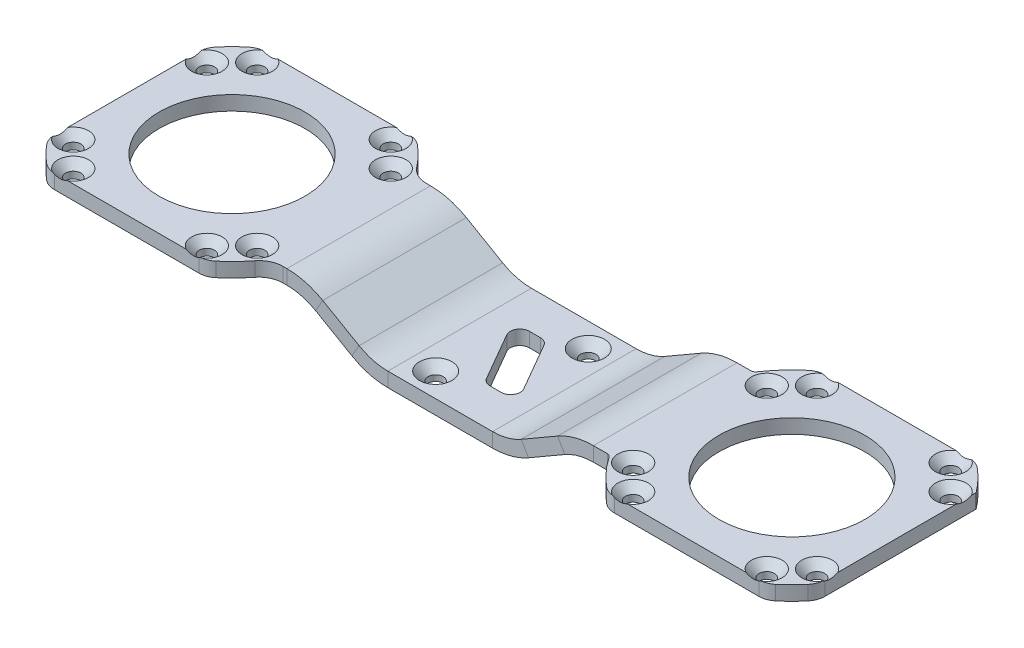
from build123d import *

# Parameters (mm, degrees)
SM_BASE_FLANGE_3_DEPTH       = 3
OTHER_START                  = -3
OTHER_2_DEPTH                = 3
OTHER_START_2                = 5
OTHER_2_2_DEPTH              = 3
OTHER_START_3                = -22
OTHER_2_3_DEPTH              = 44
OTHER_START_4                = -15
OTHER_2_4_DEPTH              = 30
OTHER_START_5                = -4
OTHER_2_5_DEPTH              = 9
OTHER_2_6_DEPTH              = 3
OTHER_2_7_DEPTH              = 3
SKETCH_15_R                  = 11.525
CUT_EXTRUDE_1_DEPTH          = 50
OTHER_4_DEPTH                = 44
OTHER_4_2_DEPTH              = 3.4749999
OTHER_START_6                = 11.5250001
OTHER_4_3_DEPTH              = 3.4749999
OTHER_4_4_DEPTH              = 44
OTHER_START_7                = -11
OTHER_4_5_OUTLINE_R          = 11.525
OTHER_4_5_DEPTH              = 11
SKETCH_31_R                  = 1.6
CUT_EXTRUDE_2_DEPTH          = 10
CUT_EXTRUDE_5_DEPTH          = 56
FILLET_2_R                   = 2
FILLET_7_R                   = 4
FILLET_8_R                   = 5
FILLET_9_R                   = 1
SKETCH_45_R                  = 1.6
CUT_EXTRUDE_6_DEPTH          = 10
SKETCH_51_R                  = 15.25
CUT_EXTRUDE_8_DEPTH          = 143.943624145
HOLE_WIZARD_M3_1_D           = 3.2
HOLE_WIZARD_M3_1_DEPTH       = 3
HOLE_WIZARD_M3_1_CSINK_D     = 6.4
HOLE_WIZARD_M3_1_CSINK_ANGLE = 90
HOLE_WIZARD_M3_1_TIP         = 0.96137699
HOLE_WIZARD_M3_2_D           = 3.2
HOLE_WIZARD_M3_2_DEPTH       = 3.3
HOLE_WIZARD_M3_2_CSINK_D     = 6.8
HOLE_WIZARD_M3_2_CSINK_ANGLE = 90
HOLE_WIZARD_M3_2_TIP         = 0.96137699


with BuildPart() as part:
    # 基体-法兰3: sheet metal written as solids
    # Sketch 1 → 基体-法兰3 (new body)
    with BuildSketch(Plane(origin=(0, 0, 0), x_dir=(1, 0, 0), z_dir=(0, 1, 0))):
        with BuildLine():
            Line((23.048861143, 15), (93.951138857, 15))
            ThreePointArc((93.951138857, 15), (96.91821461, 18.787546289), (100.5, 22))
            Line((100.5, 22), (133.5, 22))
            ThreePointArc((133.5, 22), (136.445436483, 19.445436483), (139, 16.5))
            Line((139, 16.5), (139, -16.5))
            ThreePointArc((139, -16.5), (136.445436483, -19.445436483), (133.5, -22))
            Line((133.5, -22), (100.5, -22))
            ThreePointArc((100.5, -22), (96.91821461, -18.787546289), (93.951138857, -15))
            Line((93.951138857, -15), (23.048861143, -15))
            ThreePointArc((23.048861143, -15), (20.08178539, -18.787546289), (16.5, -22))
            Line((16.5, -22), (-16.5, -22))
            ThreePointArc((-16.5, -22), (-19.445436483, -19.445436483), (-22, -16.5))
            Line((-22, -16.5), (-22, 16.5))
            ThreePointArc((-22, 16.5), (-19.445436483, 19.445436483), (-16.5, 22))
            Line((-16.5, 22), (16.5, 22))
            ThreePointArc((16.5, 22), (20.08178539, 18.787546289), (23.048861143, 15))
        make_face()
    extrude(amount=-SM_BASE_FLANGE_3_DEPTH)

    # Other 2: read off the stored shape, not the designer's step
    # Other 2 outline → Other 2 (cut)
    with BuildSketch(Plane(origin=(0, 0, 0), x_dir=(1, 0, 0), z_dir=(0, 1, 0)).offset(OTHER_START)):
        with BuildLine():
            ThreePointArc((-20.188495911, 16.5), (-17.633932394, 19.445436482), (-14.688495911, 22))
            Line((-14.688495911, 22), (-16.5, 22))
            ThreePointArc((-16.5, 22), (-19.445436483, 19.445436483), (-22, 16.5))
            Line((-22, 16.5), (-22, -16.5))
            ThreePointArc((-22, -16.5), (-19.445436483, -19.445436483), (-16.5, -22))
            Line((-16.5, -22), (-14.688495911, -22))
            ThreePointArc((-14.688495911, -22), (-17.633932393, -19.445436482), (-20.188495911, -16.5))
            Line((-20.188495911, -16.5), (-20.188495911, 16.5))
        make_face()
    extrude(amount=OTHER_2_DEPTH, mode=Mode.SUBTRACT)

    # Other 2 3 outline → Other 2 3 (cut)
    with BuildSketch(Plane.XY.offset(OTHER_START_3)):
        with BuildLine():
            Line((41.86824701, -0.990381057), (40.1528567, 0))
            Line((40.1528567, 0), (-20.188495911, 0))
            Line((-20.188495911, 0), (-20.188495911, -3))
            Line((-20.188495911, -3), (49.36824701, -3))
            ThreePointArc((49.36824701, -3), (45.485961334, -2.488887394), (41.86824701, -0.990381057))
        make_face()
    extrude(amount=OTHER_2_3_DEPTH, mode=Mode.SUBTRACT)



with BuildPart() as body_2:
    # Other 2 2 outline → Other 2 2 (new body)
    with BuildSketch(Plane(origin=(0, 0, 0), x_dir=(1, 0, 0), z_dir=(0, 1, 0)).offset(OTHER_START_2)):
        with BuildLine():
            Line((23.048861143, 15), (24.860365233, 15))
            ThreePointArc((24.860365233, 15), (21.893289479, 18.787546289), (18.311504089, 22))
            Line((18.311504089, 22), (16.5, 22))
            ThreePointArc((16.5, 22), (20.08178539, 18.787546289), (23.048861143, 15))
        make_face()
        with BuildLine():
            ThreePointArc((23.048861143, -15), (20.08178539, -18.787546289), (16.5, -22))
            Line((16.5, -22), (18.311504089, -22))
            ThreePointArc((18.311504089, -22), (21.893289479, -18.787546289), (24.860365233, -15))
            Line((24.860365233, -15), (23.048861143, -15))
        make_face()
    extrude(amount=OTHER_2_2_DEPTH)


with BuildPart() as part_1:
    add(part.part)

    add(body_2.part)  # Other 2 4 merges body 2
    # Other 2 4 outline → Other 2 4 (add)
    with BuildSketch(Plane.XY.offset(OTHER_START_4)):
        with BuildLine():
            ThreePointArc((49.36824701, 0), (46.262418469, 0.408890085), (43.36824701, 1.607695155))
            Line((43.36824701, 1.607695155), (35.777212354, 5.990381057))
            ThreePointArc((35.777212354, 5.990381057), (32.15949803, 7.488887394), (28.277212354, 8))
            Line((28.277212354, 8), (-20.188495911, 8))
            Line((-20.188495911, 8), (-20.188495911, 5))
            Line((-20.188495911, 5), (28.277212354, 5))
            ThreePointArc((28.277212354, 5), (31.383040895, 4.591109915), (34.277212354, 3.392304845))
            Line((34.277212354, 3.392304845), (40.1528567, 0))
            Line((40.1528567, 0), (49.36824701, 0))
        make_face()
    extrude(amount=OTHER_2_4_DEPTH)

    # Other 2 5 outline → Other 2 5 (cut)
    with BuildSketch(Plane(origin=(0, 0, 0), x_dir=(1, 0, 0), z_dir=(0, 1, 0)).offset(OTHER_START_5)):
        with BuildLine():
            ThreePointArc((100.5, 22), (96.91821461, 18.787546289), (93.951138857, 15))
            Line((93.951138857, 15), (95.762642946, 15))
            ThreePointArc((95.762642946, 15), (98.7297187, 18.787546289), (102.311504089, 22))
            Line((102.311504089, 22), (100.5, 22))
        make_face()
        with BuildLine():
            Line((95.762642946, -15), (93.951138857, -15))
            ThreePointArc((93.951138857, -15), (96.91821461, -18.787546289), (100.5, -22))
            Line((100.5, -22), (102.311504089, -22))
            ThreePointArc((102.311504089, -22), (98.7297187, -18.787546289), (95.762642946, -15))
        make_face()
    extrude(amount=OTHER_2_5_DEPTH, mode=Mode.SUBTRACT)

    # Other 2 6 outline → Other 2 6 (add)
    with BuildSketch(Plane(origin=(0, 0, 0), x_dir=(1, 0, 0), z_dir=(0, 1, 0)).offset(OTHER_START_2)):
        with BuildLine():
            Line((16.5, 22), (-14.688495911, 22))
            ThreePointArc((-14.688495911, 22), (-17.633932394, 19.445436482), (-20.188495911, 16.5))
            Line((-20.188495911, 16.5), (-20.188495911, 15))
            Line((-20.188495911, 15), (23.048861143, 15))
            ThreePointArc((23.048861143, 15), (20.08178539, 18.787546289), (16.5, 22))
        make_face()
        with BuildLine():
            Line((23.048861143, -15), (-20.188495911, -15))
            Line((-20.188495911, -15), (-20.188495911, -16.5))
            ThreePointArc((-20.188495911, -16.5), (-17.633932393, -19.445436482), (-14.688495911, -22))
            Line((-14.688495911, -22), (16.5, -22))
            ThreePointArc((16.5, -22), (20.08178539, -18.787546289), (23.048861143, -15))
        make_face()
    extrude(amount=OTHER_2_6_DEPTH)

    # Other 2 7 outline → Other 2 7 (add)
    with BuildSketch(Plane(origin=(0, 0, 0), x_dir=(1, 0, 0), z_dir=(0, 1, 0)).offset(OTHER_START)):
        with BuildLine():
            Line((135.311504089, 22), (133.5, 22))
            ThreePointArc((133.5, 22), (136.445436483, 19.445436483), (139, 16.5))
            Line((139, 16.5), (139, -16.5))
            ThreePointArc((139, -16.5), (136.445436483, -19.445436483), (133.5, -22))
            Line((133.5, -22), (135.311504089, -22))
            ThreePointArc((135.311504089, -22), (138.256940572, -19.445436483), (140.811504089, -16.5))
            Line((140.811504089, -16.5), (140.811504089, 16.5))
            ThreePointArc((140.811504089, 16.5), (138.256940572, 19.445436483), (135.311504089, 22))
        make_face()
    extrude(amount=OTHER_2_7_DEPTH)

    # 草图15 → 切除-拉伸1 (cut)
    with BuildSketch(Plane(origin=(0, 8, 0), x_dir=(1, 0, 0), z_dir=(0, 1, 0))):
        with Locations(Location((118.811504089, 0, 0), (0, 0, 270))):
            Circle(SKETCH_15_R)
        with Locations(Location((1.811504089, 0, 0), (0, 0, 270))):
            Circle(SKETCH_15_R)
    extrude(amount=-CUT_EXTRUDE_1_DEPTH, mode=Mode.SUBTRACT)

    # Other 4: read off the stored shape, not the designer's step
    # Other 4 outline → Other 4 (cut)
    with BuildSketch(Plane.XY.offset(OTHER_START_3)):
        with BuildLine():
            Line((49.36824701, -3), (83.130405515, -3))
            Line((83.130405515, -3), (84.845795825, -2.009618943))
            ThreePointArc((84.845795825, -2.009618943), (88.463510149, -0.511112606), (92.345795825, 0))
            Line((92.345795825, 0), (49.36824701, 0))
            ThreePointArc((49.36824701, 0), (46.262418469, 0.408890085), (43.36824701, 1.607695155))
            Line((43.36824701, 1.607695155), (35.777212354, 5.990381057))
            ThreePointArc((35.777212354, 5.990381057), (32.15949803, 7.488887394), (28.277212354, 8))
            Line((28.277212354, 8), (-20.188495911, 8))
            Line((-20.188495911, 8), (-20.188495911, 5))
            Line((-20.188495911, 5), (28.277212354, 5))
            ThreePointArc((28.277212354, 5), (31.383040895, 4.591109915), (34.277212354, 3.392304845))
            Line((34.277212354, 3.392304845), (41.86824701, -0.990381057))
            ThreePointArc((41.86824701, -0.990381057), (45.485961334, -2.488887394), (49.36824701, -3))
        make_face()
    extrude(amount=OTHER_4_DEPTH, mode=Mode.SUBTRACT)

    # Other 4 2 outline → Other 4 2 (add)
    with BuildSketch(Plane.XY.offset(OTHER_START_4)):
        with BuildLine():
            ThreePointArc((77.254761168, -6.392304845), (74.360589709, -7.591109915), (71.254761168, -8))
            Line((71.254761168, -8), (49.36824701, -8))
            ThreePointArc((49.36824701, -8), (46.262418469, -7.591109915), (43.36824701, -6.392304845))
            Line((43.36824701, -6.392304845), (35.777212354, -2.009618943))
            ThreePointArc((35.777212354, -2.009618943), (32.15949803, -0.511112606), (28.277212354, 0))
            Line((28.277212354, 0), (-20.188495911, 0))
            Line((-20.188495911, 0), (-20.188495911, -3))
            Line((-20.188495911, -3), (28.277212354, -3))
            ThreePointArc((28.277212354, -3), (31.383040895, -3.408890085), (34.277212354, -4.607695155))
            Line((34.277212354, -4.607695155), (41.86824701, -8.990381057))
            ThreePointArc((41.86824701, -8.990381057), (45.485961334, -10.488887394), (49.36824701, -11))
            Line((49.36824701, -11), (71.254761168, -11))
            ThreePointArc((71.254761168, -11), (75.137046844, -10.488887394), (78.754761168, -8.990381057))
            Line((78.754761168, -8.990381057), (86.345795825, -4.607695155))
            ThreePointArc((86.345795825, -4.607695155), (89.239967284, -3.408890085), (92.345795825, -3))
            Line((92.345795825, -3), (83.130405515, -3))
            Line((83.130405515, -3), (77.254761168, -6.392304845))
        make_face()
    extrude(amount=OTHER_4_2_DEPTH)

    # Other 4 3 outline → Other 4 3 (add)
    with BuildSketch(Plane.XY.offset(OTHER_START_6)):
        with BuildLine():
            ThreePointArc((77.254761168, -6.392304845), (74.360589709, -7.591109915), (71.254761168, -8))
            Line((71.254761168, -8), (49.36824701, -8))
            ThreePointArc((49.36824701, -8), (46.262418469, -7.591109915), (43.36824701, -6.392304845))
            Line((43.36824701, -6.392304845), (35.777212354, -2.009618943))
            ThreePointArc((35.777212354, -2.009618943), (32.15949803, -0.511112606), (28.277212354, 0))
            Line((28.277212354, 0), (-20.188495911, 0))
            Line((-20.188495911, 0), (-20.188495911, -3))
            Line((-20.188495911, -3), (28.277212354, -3))
            ThreePointArc((28.277212354, -3), (31.383040895, -3.408890085), (34.277212354, -4.607695155))
            Line((34.277212354, -4.607695155), (41.86824701, -8.990381057))
            ThreePointArc((41.86824701, -8.990381057), (45.485961334, -10.488887394), (49.36824701, -11))
            Line((49.36824701, -11), (71.254761168, -11))
            ThreePointArc((71.254761168, -11), (75.137046844, -10.488887394), (78.754761168, -8.990381057))
            Line((78.754761168, -8.990381057), (86.345795825, -4.607695155))
            ThreePointArc((86.345795825, -4.607695155), (89.239967284, -3.408890085), (92.345795825, -3))
            Line((92.345795825, -3), (83.130405515, -3))
            Line((83.130405515, -3), (77.254761168, -6.392304845))
        make_face()
    extrude(amount=OTHER_4_3_DEPTH)

    # Other 4 4 outline → Other 4 4 (add)
    with BuildSketch(Plane.XY.offset(OTHER_START_3)):
        with BuildLine():
            ThreePointArc((77.254761168, -6.392304845), (74.360589709, -7.591109915), (71.254761168, -8))
            Line((71.254761168, -8), (49.36824701, -8))
            ThreePointArc((49.36824701, -8), (46.262418469, -7.591109915), (43.36824701, -6.392304845))
            Line((43.36824701, -6.392304845), (35.777212354, -2.009618943))
            ThreePointArc((35.777212354, -2.009618943), (32.15949803, -0.511112606), (28.277212354, 0))
            Line((28.277212354, 0), (-20.188495911, 0))
            Line((-20.188495911, 0), (-20.188495911, -3))
            Line((-20.188495911, -3), (28.277212354, -3))
            ThreePointArc((28.277212354, -3), (31.383040895, -3.408890085), (34.277212354, -4.607695155))
            Line((34.277212354, -4.607695155), (41.86824701, -8.990381057))
            ThreePointArc((41.86824701, -8.990381057), (45.485961334, -10.488887394), (49.36824701, -11))
            Line((49.36824701, -11), (71.254761168, -11))
            ThreePointArc((71.254761168, -11), (75.137046844, -10.488887394), (78.754761168, -8.990381057))
            Line((78.754761168, -8.990381057), (86.345795825, -4.607695155))
            ThreePointArc((86.345795825, -4.607695155), (89.239967284, -3.408890085), (92.345795825, -3))
            Line((92.345795825, -3), (83.130405515, -3))
            Line((83.130405515, -3), (77.254761168, -6.392304845))
        make_face()
    extrude(amount=OTHER_4_4_DEPTH)

    # Other 4 5 outline → Other 4 5 (cut)
    with BuildSketch(Plane(origin=(0, 0, 0), x_dir=(1, 0, 0), z_dir=(0, 1, 0)).offset(OTHER_START_7)):
        with BuildLine():
            Line((94, -15), (24.860365233, -15))
            ThreePointArc((24.860365233, -15), (21.893289479, -18.787546289), (18.311504089, -22))
            Line((18.311504089, -22), (94, -22))
            Line((94, -22), (94, -15))
        make_face()
        with BuildLine():
            Line((24.860365233, 15), (94, 15))
            Line((94, 15), (94, 22))
            Line((94, 22), (18.311504089, 22))
            ThreePointArc((18.311504089, 22), (21.893289479, 18.787546289), (24.860365233, 15))
        make_face()
        with BuildLine():
            Line((-20.188495911, -22), (-14.688495911, -22))
            ThreePointArc((-14.688495911, -22), (-17.633932393, -19.445436482), (-20.188495911, -16.5))
            Line((-20.188495911, -16.5), (-20.188495911, -22))
        make_face()
        with BuildLine():
            Line((-20.188495911, 22), (-20.188495911, 16.5))
            ThreePointArc((-20.188495911, 16.5), (-17.633932394, 19.445436482), (-14.688495911, 22))
            Line((-14.688495911, 22), (-20.188495911, 22))
        make_face()
        with Locations((1.811504089, 0)):
            Circle(OTHER_4_5_OUTLINE_R)
    extrude(amount=OTHER_4_5_DEPTH, mode=Mode.SUBTRACT)

    # 草图31 → 切除-拉伸2 (cut)
    with BuildSketch(Plane(origin=(0, 0, 0), x_dir=(1, 0, 0), z_dir=(0, 1, 0))):
        with Locations(Location((-12.148395653, 19.214153616, 0), (0, 0, 270))):
            Circle(SKETCH_31_R)
        with Locations(Location((-17.402649527, 13.959899742, 0), (0, 0, 270))):
            Circle(SKETCH_31_R)
        with Locations(Location((21.025657706, 13.959899742, 0), (0, 0, 270))):
            Circle(SKETCH_31_R)
        with Locations(Location((15.771403831, 19.214153616, 0), (0, 0, 270))):
            Circle(SKETCH_31_R)
        with Locations(Location((21.025657706, -13.959899742, 0), (0, 0, 270))):
            Circle(SKETCH_31_R)
        with Locations(Location((15.771403831, -19.214153616, 0), (0, 0, 270))):
            Circle(SKETCH_31_R)
        with Locations(Location((-17.402649527, -13.959899742, 0), (0, 0, 270))):
            Circle(SKETCH_31_R)
        with Locations(Location((-12.148395653, -19.214153616, 0), (0, 0, 270))):
            Circle(SKETCH_31_R)
        with Locations(Location((132.771403831, -19.214153616, 0), (0, 0, 270))):
            Circle(SKETCH_31_R)
        with Locations(Location((138.025657706, -13.959899742, 0), (0, 0, 270))):
            Circle(SKETCH_31_R)
        with Locations(Location((104.851604347, -19.214153616, 0), (0, 0, 270))):
            Circle(SKETCH_31_R)
        with Locations(Location((99.597350473, -13.959899742, 0), (0, 0, 270))):
            Circle(SKETCH_31_R)
        with Locations(Location((104.851604347, 19.214153616, 0), (0, 0, 270))):
            Circle(SKETCH_31_R)
        with Locations(Location((99.597350473, 13.959899742, 0), (0, 0, 270))):
            Circle(SKETCH_31_R)
        with Locations(Location((138.025657706, 13.959899742, 0), (0, 0, 270))):
            Circle(SKETCH_31_R)
        with Locations(Location((132.771403831, 19.214153616, 0), (0, 0, 270))):
            Circle(SKETCH_31_R)
    extrude(amount=-CUT_EXTRUDE_2_DEPTH, mode=Mode.SUBTRACT)

    # 草图36 → 切除-拉伸5 (cut)
    with BuildSketch(Plane(origin=(0, -8, 0), x_dir=(1, 0, 0), z_dir=(0, 1, 0))):
        Polygon((61.577350269, -7), (53.494446501, 7), (60.422649731, 7), (68.505553499, -7), align=None)
    extrude(amount=-CUT_EXTRUDE_5_DEPTH, mode=Mode.SUBTRACT)

    # 圆角2
    fillet_2_edges = [part_1.edges().sort_by_distance(p)[0] for p in [
        (53.494446501, -9.5, -7),
        (60.422649731, -9.5, -7),
        (68.505553499, -9.5, 7),
        (61.577350269, -9.5, 7),
    ]]
    fillet(fillet_2_edges, radius=FILLET_2_R)

    # 圆角7
    fillet_7_edges = [part_1.edges().sort_by_distance(p)[0] for p in [
        (18.311504089, -1.5, -22),
        (-14.688495911, -1.5, -22),
        (-20.188495911, -1.5, -16.5),
        (-20.188495911, -1.5, 16.5),
        (-14.688495911, -1.5, 22),
        (18.311504089, -1.5, 22),
        (102.311504089, -1.5, 22),
        (135.311504089, -1.5, 22),
        (140.811504089, -1.5, 16.5),
        (135.311504089, -1.5, -22),
        (102.311504089, -1.5, -22),
    ]]
    fillet(fillet_7_edges, radius=FILLET_7_R)

    # 圆角8
    fillet_8_edges = [part_1.edges().sort_by_distance(p)[0] for p in [
        (24.860365233, -1.5, 15),
        (24.860365233, -1.5, -15),
    ]]
    fillet(fillet_8_edges, radius=FILLET_8_R)

    # 圆角9
    fillet_9_edges = [part_1.edges().sort_by_distance(p)[0] for p in [
        (95.762642946, -1.5, -15),
        (95.762642946, -1.5, 15),
    ]]
    fillet(fillet_9_edges, radius=FILLET_9_R)

    # 草图45 → 切除-拉伸6 (cut)
    with BuildSketch(Plane(origin=(0, -8, 0), x_dir=(1, 0, 0), z_dir=(0, 1, 0))):
        with Locations(Location((66.254761168, 10, 0), (0, 0, 270))):
            Circle(SKETCH_45_R)
        with Locations(Location((54.36824701, -10, 0), (0, 0, 270))):
            Circle(SKETCH_45_R)
    extrude(amount=-CUT_EXTRUDE_6_DEPTH, mode=Mode.SUBTRACT)

    # 草图51 → 切除-拉伸8 (cut, through all)
    with BuildSketch(Plane(origin=(0, 0, 0), x_dir=(1, 0, 0), z_dir=(0, 1, 0))):
        with Locations(Location((1.811504089, 0, 0), (0, 0, 270))):
            Circle(SKETCH_51_R)
        with Locations(Location((118.811504089, 0, 0), (0, 0, 270))):
            Circle(SKETCH_51_R)
    extrude(amount=-CUT_EXTRUDE_8_DEPTH, mode=Mode.SUBTRACT)

    # M3 十字槽半沉头木螺钉的锥形沉头孔1
    with Locations(Plane(origin=(0, 0, 0), x_dir=(1, 0, 0), z_dir=(0, 1, 0))):
        with Locations((99.597350473, -13.959899742), (-12.148395653, 19.214153616), (-17.402649527, 13.959899742), (-17.402649527, -13.959899742), (-12.148395653, -19.214153616), (15.771403831, -19.214153616), (21.025657706, -13.959899742), (21.025657706, 13.959899742), (15.771403831, 19.214153616), (104.851604347, 19.214153616), (99.597350473, 13.959899742), (138.025657706, 13.959899742), (132.771403831, 19.214153616), (138.025657706, -13.959899742), (132.771403831, -19.214153616), (104.851604347, -19.214153616)):
            CounterSinkHole(HOLE_WIZARD_M3_1_D / 2, HOLE_WIZARD_M3_1_CSINK_D / 2, depth=HOLE_WIZARD_M3_1_DEPTH, counter_sink_angle=HOLE_WIZARD_M3_1_CSINK_ANGLE)
            with Locations((0, 0, -(HOLE_WIZARD_M3_1_DEPTH + HOLE_WIZARD_M3_1_TIP / 2))):  # 118° drill point
                Cone(0, HOLE_WIZARD_M3_1_D / 2, HOLE_WIZARD_M3_1_TIP, mode=Mode.SUBTRACT)

    # M3 十字槽半沉头木螺钉的锥形沉头孔2
    with Locations(Plane(origin=(0, -8, 0), x_dir=(1, 0, 0), z_dir=(0, 1, 0))):
        with Locations((66.254761168, 10), (54.36824701, -10)):
            CounterSinkHole(HOLE_WIZARD_M3_2_D / 2, HOLE_WIZARD_M3_2_CSINK_D / 2, depth=HOLE_WIZARD_M3_2_DEPTH, counter_sink_angle=HOLE_WIZARD_M3_2_CSINK_ANGLE)
            with Locations((0, 0, -(HOLE_WIZARD_M3_2_DEPTH + HOLE_WIZARD_M3_2_TIP / 2))):  # 118° drill point
                Cone(0, HOLE_WIZARD_M3_2_D / 2, HOLE_WIZARD_M3_2_TIP, mode=Mode.SUBTRACT)


solid = part_1.part
